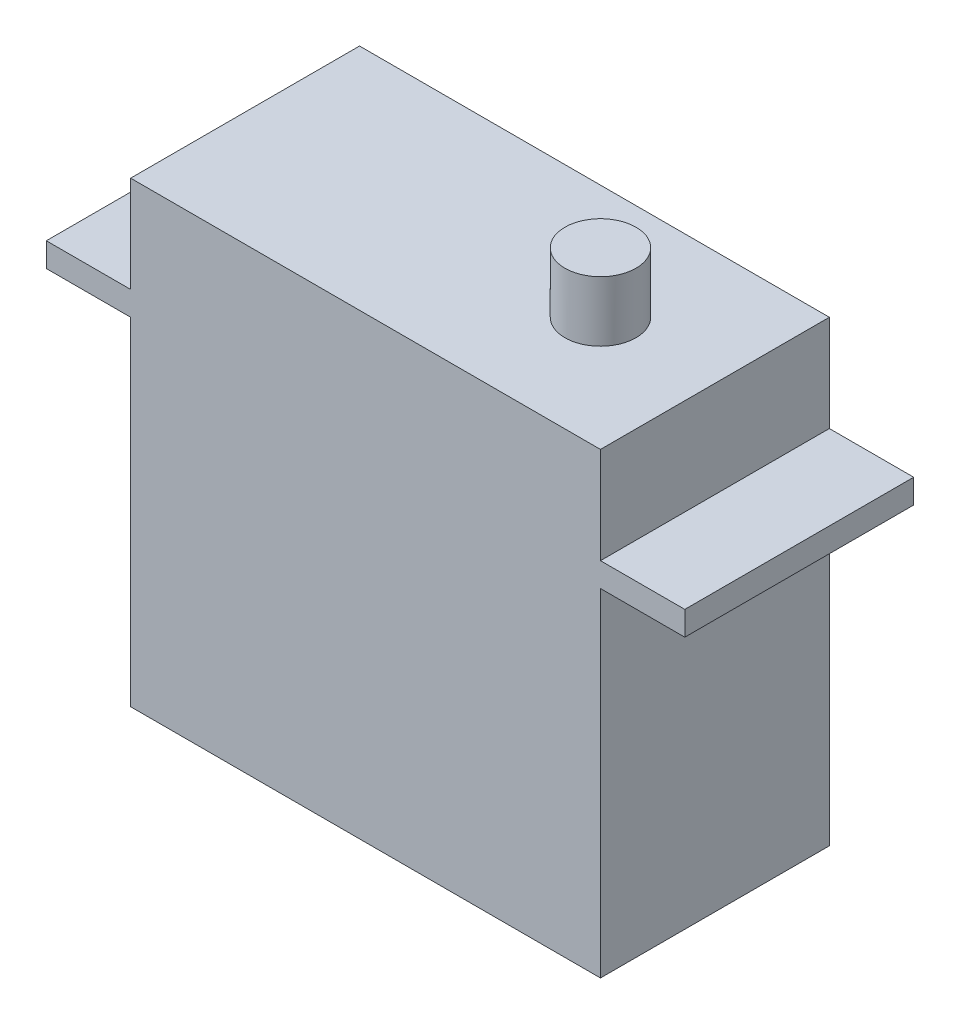
from build123d import *

# Parameters (mm, degrees)
BOSS_EXTRU_1_DEPTH = 19
ESQUISSE2_R        = 2.95
BOSS_EXTRU_2_DEPTH = 5


with BuildPart() as part:
    # Esquisse1 → Boss.-Extru.1 (new body)
    with BuildSketch(Plane.XY):
        Polygon((0, 28), (0, 0), (39, 0), (39, 28), (46, 28), (46, 30), (39, 30), (39, 38), (0, 38), (0, 30), (-7, 30), (-7, 28), align=None)
    extrude(amount=BOSS_EXTRU_1_DEPTH)

    # Esquisse2 → Boss.-Extru.2 (add)
    with BuildSketch(Plane(origin=(0, 38, 0), x_dir=(1, 0, 0), z_dir=(0, 1, 0))):
        with Locations((29.5, -9.5)):
            Circle(ESQUISSE2_R)
    extrude(amount=BOSS_EXTRU_2_DEPTH)


solid = part.part
